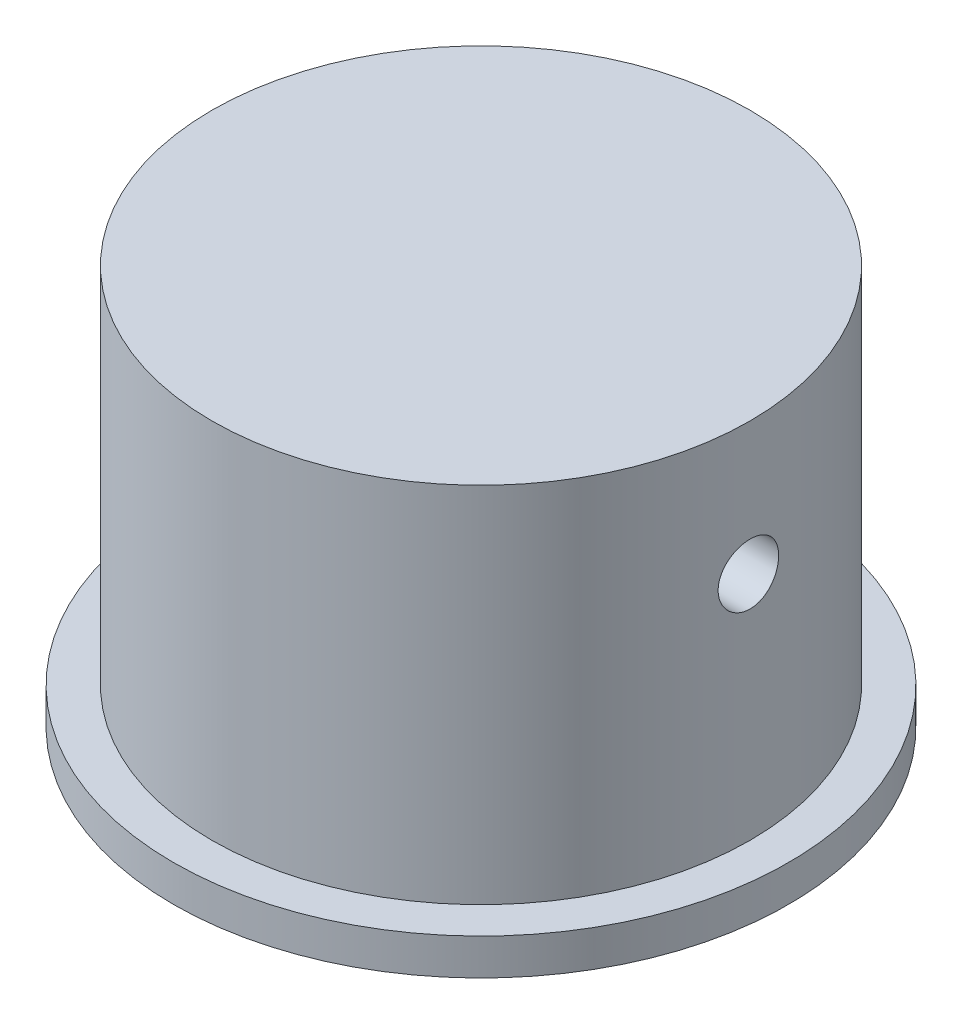
from build123d import *


with BuildPart() as part:
    # Sketch1 → Revolve1 (revolve)
    with BuildSketch(Plane(origin=(0, 0, 0), x_dir=(0, 0, -1), z_dir=(1, 0, 0))):
        Polygon((-12.7, 0), (-12.7, 1.5), (-11.1125, 1.5), (-11.1125, 16.5), (0, 16.5), (0, 5), (-2.8067, 5), (-2.8067, 0), align=None)
    revolve(axis=Axis((0, -1000, 0), (0, 1, 0)))

    # Sketch4 → M3x0.5 Tapped Hole1 (revolve, cut)
    with BuildSketch(Plane(origin=(11.1125, 11.025, 0), x_dir=(0, 0, -1), z_dir=(0, 1, 0))):
        Polygon((0, 0), (0, 10.751075774), (1.25, 10), (1.25, 0), align=None)
    m3x0_5_tapped_hole1 = revolve(axis=Axis((17.4625, 11.025, 0), (-1, 0, 0)), mode=Mode.SUBTRACT)

    # Mirror1: M3x0.5 Tapped Hole1 across plane
    add(m3x0_5_tapped_hole1.mirror(Plane(origin=(0, 0, 0), x_dir=(0, 0, 1), z_dir=(1, 0, 0))), mode=Mode.SUBTRACT)


solid = part.part
